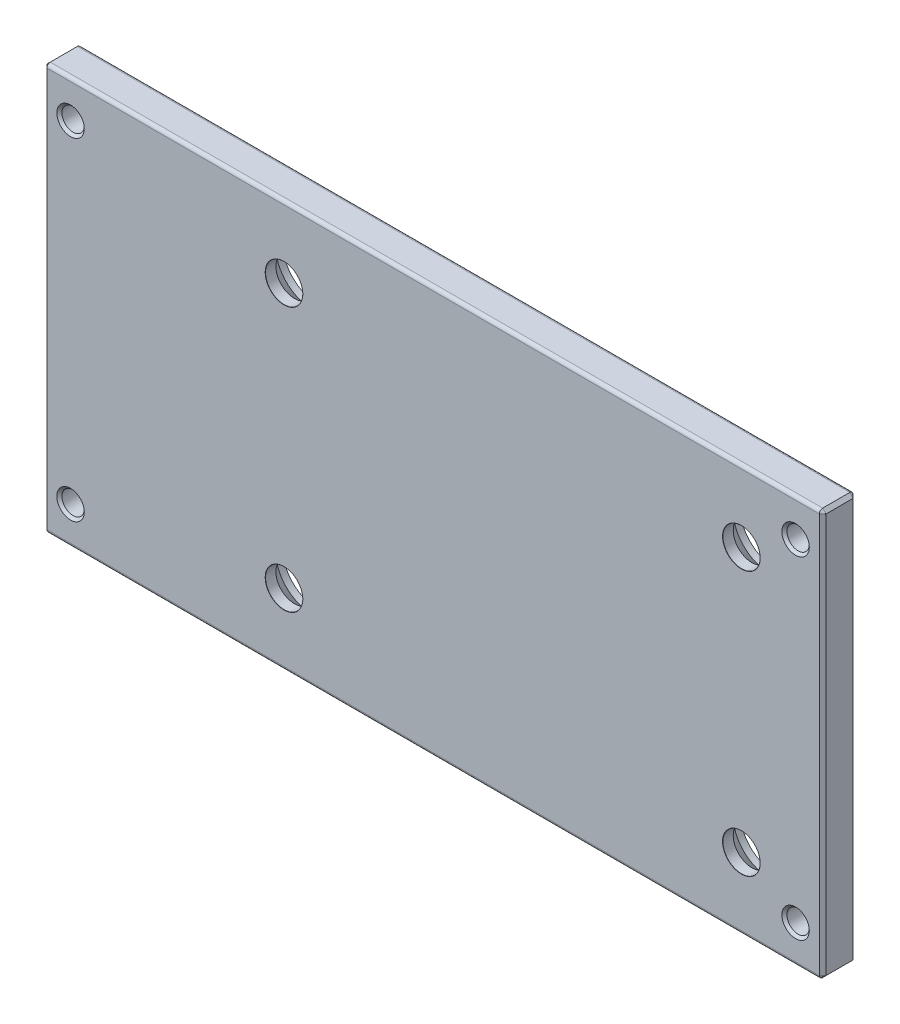
from build123d import *

# Parameters (mm, degrees)
SKETCH1_W                                    = 5
SKETCH1_H                                    = 60
BOSS_EXTRUDE1_DEPTH                          = 57.5
M4_TAPPED_HOLE1_AT_2_COUNT                   = 2
M4_TAPPED_HOLE1_AT_2_PITCH                   = 107
M4_TAPPED_HOLE1_AT_3_COUNT                   = 2
M4_TAPPED_HOLE1_AT_3_PITCH                   = 49
M4_TAPPED_HOLE1_AT_4_COUNT                   = 2
M4_TAPPED_HOLE1_AT_4_PITCH                   = 117.686022959
CSK_FOR_M5_COUNTERSUNK_FLAT_HEAD_SCR_2_COUNT = 2
CSK_FOR_M5_COUNTERSUNK_FLAT_HEAD_SCR_2_PITCH = 77.956718761
CSK_FOR_M5_COUNTERSUNK_FLAT_HEAD_SCR_3_COUNT = 2
CSK_FOR_M5_COUNTERSUNK_FLAT_HEAD_SCR_3_PITCH = 67.5
CSK_FOR_M5_COUNTERSUNK_FLAT_HEAD_SCR_4_COUNT = 2
CSK_FOR_M5_COUNTERSUNK_FLAT_HEAD_SCR_4_PITCH = 39
FILLET1_R                                    = 0.5
CHAMFER1_SIZE                                = 0.5


with BuildPart() as part:
    # Sketch1 → Boss-Extrude1 (new, symmetric)
    with BuildSketch(Plane(origin=(0, 0, 0), x_dir=(0, 0, -1), z_dir=(1, 0, 0))):
        Rectangle(SKETCH1_W, SKETCH1_H)
    extrude(amount=BOSS_EXTRUDE1_DEPTH, both=True)

    # Sketch3 → M4 Tapped Hole1 (revolve, cut)
    with BuildSketch(Plane(origin=(-53.5, 24.5, 2.5), x_dir=(0, -1, 0), z_dir=(1, 0, 0))):
        Polygon((0, 0), (0, 5), (2.025, 5), (1.65, 4.625), (1.65, 0.375), (2.025, 0), align=None)
    m4_tapped_hole1 = revolve(axis=Axis((-53.5, 24.5, 8.85), (0, 0, -1)), mode=Mode.SUBTRACT)

    # M4 Tapped Hole1 at 2: M4 Tapped Hole1 ×2
    with Locations(*[(i * M4_TAPPED_HOLE1_AT_2_PITCH, 0, 0) for i in range(1, M4_TAPPED_HOLE1_AT_2_COUNT)]):
        add(m4_tapped_hole1, mode=Mode.SUBTRACT)

    # M4 Tapped Hole1 at 3: M4 Tapped Hole1 ×2
    with Locations(*[(0, -i * M4_TAPPED_HOLE1_AT_3_PITCH, 0) for i in range(1, M4_TAPPED_HOLE1_AT_3_COUNT)]):
        add(m4_tapped_hole1, mode=Mode.SUBTRACT)

    # M4 Tapped Hole1 at 4: M4 Tapped Hole1 ×2
    with Locations(*[Vector(0.909198877736867, -0.4163621028888457, 0) * (i * M4_TAPPED_HOLE1_AT_4_PITCH) for i in range(1, M4_TAPPED_HOLE1_AT_4_COUNT)]):
        add(m4_tapped_hole1, mode=Mode.SUBTRACT)

    # Sketch6 → CSK for M5 Countersunk Flat Head Screw1 (revolve, cut)
    with BuildSketch(Plane(origin=(-22, 19.5, -2.5), x_dir=(0, 1, 0), z_dir=(1, 0, 0))):
        Polygon((0, 0), (0, 5), (2.775, 5), (2.75, 4.975), (2.75, 3.45), (5.2, 1), (5.2, 0), align=None)
    csk_for_m5_countersunk_flat_head_screw1 = revolve(axis=Axis((-22, 19.5, -8.85), (0, 0, 1)), mode=Mode.SUBTRACT)

    # CSK for M5 Countersunk Flat Head Scr 2: CSK for M5 Countersunk Flat Head Screw1 ×2
    with Locations(*[Vector(0.8658650732445505, -0.5002775978746292, 0) * (i * CSK_FOR_M5_COUNTERSUNK_FLAT_HEAD_SCR_2_PITCH) for i in range(1, CSK_FOR_M5_COUNTERSUNK_FLAT_HEAD_SCR_2_COUNT)]):
        add(csk_for_m5_countersunk_flat_head_screw1, mode=Mode.SUBTRACT)

    # CSK for M5 Countersunk Flat Head Scr 3: CSK for M5 Countersunk Flat Head Screw1 ×2
    with Locations(*[(i * CSK_FOR_M5_COUNTERSUNK_FLAT_HEAD_SCR_3_PITCH, 0, 0) for i in range(1, CSK_FOR_M5_COUNTERSUNK_FLAT_HEAD_SCR_3_COUNT)]):
        add(csk_for_m5_countersunk_flat_head_screw1, mode=Mode.SUBTRACT)

    # CSK for M5 Countersunk Flat Head Scr 4: CSK for M5 Countersunk Flat Head Screw1 ×2
    with Locations(*[(0, -i * CSK_FOR_M5_COUNTERSUNK_FLAT_HEAD_SCR_4_PITCH, 0) for i in range(1, CSK_FOR_M5_COUNTERSUNK_FLAT_HEAD_SCR_4_COUNT)]):
        add(csk_for_m5_countersunk_flat_head_screw1, mode=Mode.SUBTRACT)

    # Fillet1
    fillet1_edges = [part.edges().sort_by_distance(p)[0] for p in [
        (0, -30, -2.5),
        (0, -30, 2.5),
        (0, 30, -2.5),
        (0, 30, 2.5),
    ]]
    fillet(fillet1_edges, radius=FILLET1_R)

    # Chamfer1
    chamfer1_edges = [part.edges().sort_by_distance(p)[0] for p in [
        (57.5, -29.853553391, 2.353553391),
        (57.5, 0, 2.5),
        (57.5, 29.853553391, 2.353553391),
        (57.5, 30, 0),
        (57.5, 29.853553391, -2.353553391),
        (57.5, 0, -2.5),
        (57.5, -29.853553391, -2.353553391),
        (57.5, -30, 0),
        (-57.5, 29.853553391, -2.353553391),
        (-57.5, 30, 0),
        (-57.5, 29.853553391, 2.353553391),
        (-57.5, 0, 2.5),
        (-57.5, -29.853553391, 2.353553391),
        (-57.5, -30, 0),
        (-57.5, -29.853553391, -2.353553391),
        (-57.5, 0, -2.5),
    ]]
    chamfer(chamfer1_edges, length=CHAMFER1_SIZE)


solid = part.part
